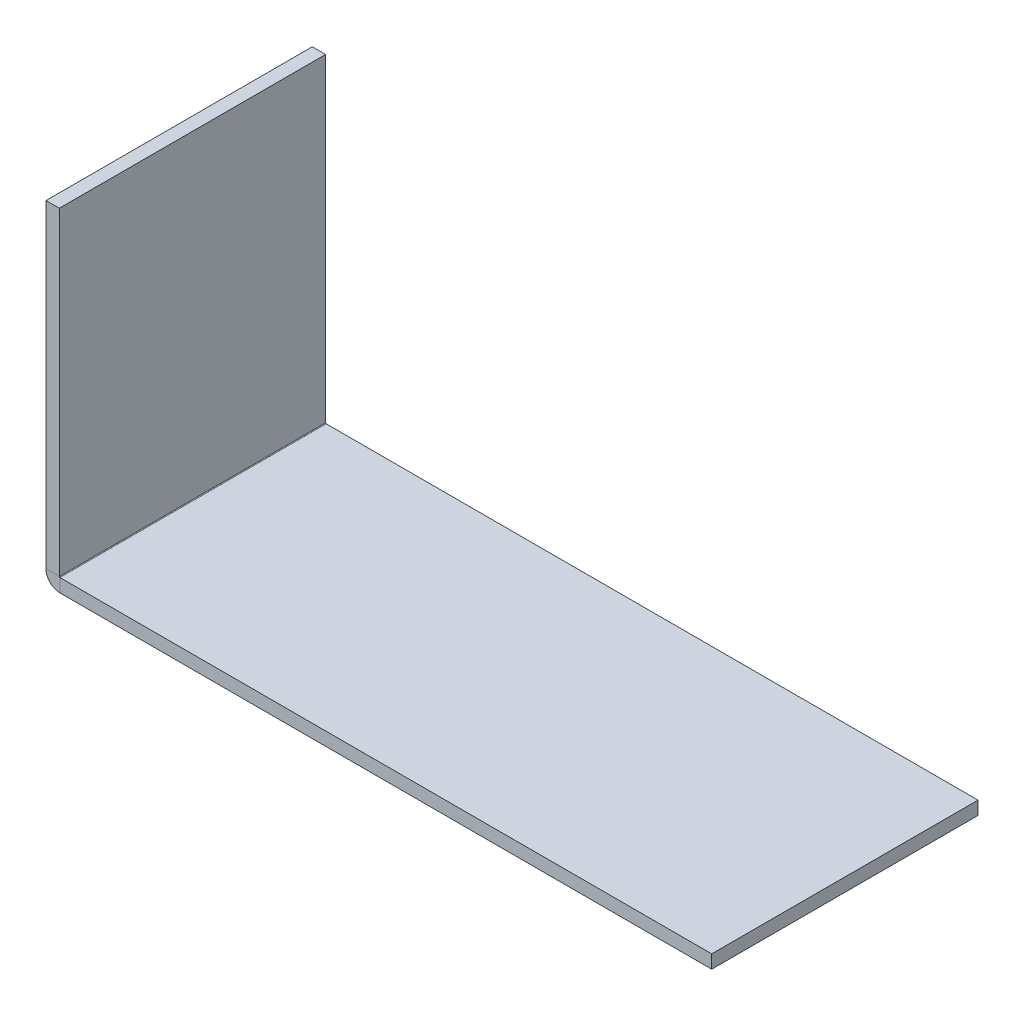
from build123d import *

# Parameters (mm, degrees)
SM_BASE_FLANGE_1_DEPTH = 40


# Sheet-metal steps are written as plain solids
with BuildPart() as part:
    # Sketch 1 → 基体-法兰1 (new body)
    with BuildSketch(Plane.XY):
        with BuildLine():
            Line((0, 50), (0, 2.1))
            ThreePointArc((0, 2.1), (0.61507576, 0.61507576), (2.1, 0))
            Line((2.1, 0), (100, 0))
            Line((100, 0), (100, 2))
            Line((100, 2), (2.1, 2))
            ThreePointArc((2.1, 2), (2.029289322, 2.029289322), (2, 2.1))
            Line((2, 2.1), (2, 50))
            Line((2, 50), (0, 50))
        make_face()
    extrude(amount=-SM_BASE_FLANGE_1_DEPTH)


solid = part.part
